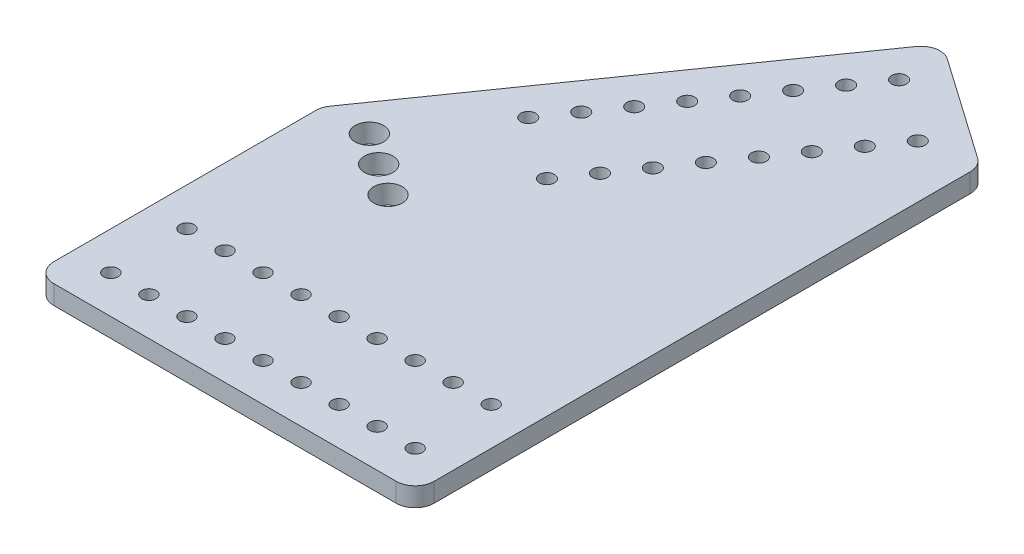
from build123d import *

# Parameters (mm, degrees)
BOSS_EXTRUDE1_DEPTH = 6.35
SKETCH2_R           = 2.413
SKETCH2_R_2         = 2.4892
SKETCH2_R_3         = 4.7625
CUT_EXTRUDE1_DEPTH  = 253.166408591
FILLET1_R           = 6.35


with BuildPart() as part:
    # Sketch1 → Boss-Extrude1 (new body)
    with BuildSketch(Plane(origin=(0, 0, 0), x_dir=(1, 0, 0), z_dir=(0, 1, 0))):
        Polygon((0, 95.812682967), (85.38707615, 217.758065572), (127, 188.620382605), (127, 0), (0, 0), align=None)
    extrude(amount=BOSS_EXTRUDE1_DEPTH)

    # Sketch2 → Cut-Extrude1 (cut, through all)
    with BuildSketch(Plane(origin=(0, 6.35, 0), x_dir=(1, 0, 0), z_dir=(0, 1, 0))):
        with Locations((12.7, 12.7)):
            Circle(SKETCH2_R)
        with Locations((12.7, 38.1)):
            Circle(SKETCH2_R)
        with Locations((25.4, 38.1)):
            Circle(SKETCH2_R)
        with Locations((38.1, 38.1)):
            Circle(SKETCH2_R)
        with Locations((50.8, 38.1)):
            Circle(SKETCH2_R)
        with Locations((63.5, 38.1)):
            Circle(SKETCH2_R)
        with Locations((25.4, 12.7)):
            Circle(SKETCH2_R)
        with Locations((38.1, 12.7)):
            Circle(SKETCH2_R)
        with Locations((50.8, 12.7)):
            Circle(SKETCH2_R)
        with Locations((63.5, 12.7)):
            Circle(SKETCH2_R)
        with Locations((76.2, 12.7)):
            Circle(SKETCH2_R)
        with Locations((76.2, 38.1)):
            Circle(SKETCH2_R)
        with Locations((88.9, 12.7)):
            Circle(SKETCH2_R)
        with Locations((88.9, 38.1)):
            Circle(SKETCH2_R)
        with Locations((101.6, 12.7)):
            Circle(SKETCH2_R)
        with Locations((101.6, 38.1)):
            Circle(SKETCH2_R)
        with Locations((88.505886371, 200.070413868)):
            Circle(SKETCH2_R_2)
        with Locations((109.312348296, 185.501572385)):
            Circle(SKETCH2_R_2)
        with Locations((81.221465629, 189.667182905)):
            Circle(SKETCH2_R_2)
        with Locations((102.027927554, 175.098341422)):
            Circle(SKETCH2_R_2)
        with Locations((73.937044888, 179.263951943)):
            Circle(SKETCH2_R_2)
        with Locations((94.743506813, 164.69511046)):
            Circle(SKETCH2_R_2)
        with Locations((66.652624146, 168.86072098)):
            Circle(SKETCH2_R_2)
        with Locations((87.459086071, 154.291879497)):
            Circle(SKETCH2_R_2)
        with Locations((59.368203404, 158.457490018)):
            Circle(SKETCH2_R_2)
        with Locations((80.174665329, 143.888648535)):
            Circle(SKETCH2_R_2)
        with Locations((52.083782663, 148.054259055)):
            Circle(SKETCH2_R_2)
        with Locations((72.890244588, 133.485417572)):
            Circle(SKETCH2_R_2)
        with Locations((44.799361921, 137.651028093)):
            Circle(SKETCH2_R_2)
        with Locations((65.605823846, 123.08218661)):
            Circle(SKETCH2_R_2)
        with Locations((37.514941179, 127.247797131)):
            Circle(SKETCH2_R_2)
        with Locations((58.321403104, 112.678955647)):
            Circle(SKETCH2_R_2)
        with Locations((15.661678954, 96.038104243)):
            Circle(SKETCH2_R_3)
        with Locations((26.064909917, 88.753683501)):
            Circle(SKETCH2_R_3)
        with Locations((36.468140879, 81.46926276)):
            Circle(SKETCH2_R_3)
        with Locations((114.3, 12.7)):
            Circle(SKETCH2_R)
        with Locations((114.3, 38.1)):
            Circle(SKETCH2_R)
    extrude(amount=-CUT_EXTRUDE1_DEPTH, mode=Mode.SUBTRACT)

    # Fillet1
    fillet1_edges = [part.edges().sort_by_distance(p)[0] for p in [
        (85.38707615, 3.175, -217.758065572),
        (127, 3.175, -188.620382605),
        (127, 3.175, 0),
        (0, 3.175, 0),
        (0, 3.175, -95.812682967),
    ]]
    fillet(fillet1_edges, radius=FILLET1_R)


solid = part.part
